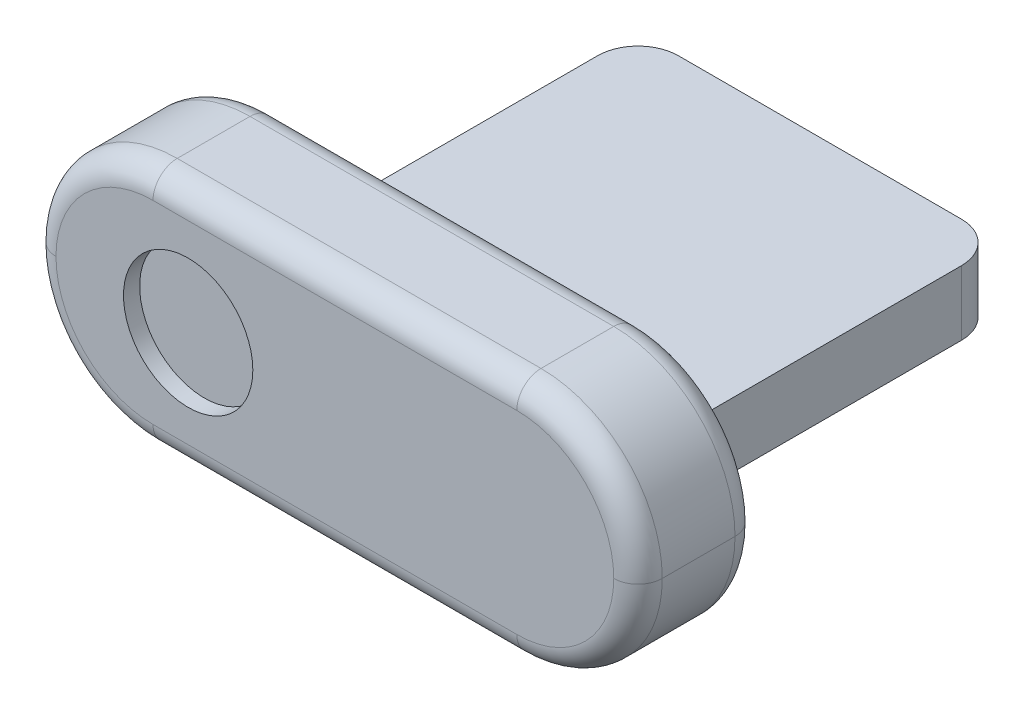
from build123d import *

# Parameters (mm, degrees)
SKETCH1_W           = 75
SKETCH1_H           = 30
BOSS_EXTRUDE1_DEPTH = 15
FILLET1_R           = 15
SKETCH2_W           = 45
SKETCH2_H           = 8
BOSS_EXTRUDE2_DEPTH = 45
FILLET2_R           = 5
FILLET3_R           = 3
SKETCH3_R           = 8
CUT_EXTRUDE1_DEPTH  = 2


with BuildPart() as part:
    # Sketch1 → Boss-Extrude1 (new body)
    with BuildSketch(Plane.XY):
        with Locations((-40, 23.52978815)):
            Rectangle(SKETCH1_W, SKETCH1_H)
    extrude(amount=-BOSS_EXTRUDE1_DEPTH)

    # Fillet1
    fillet1_edges = [part.edges().sort_by_distance(p)[0] for p in [
        (-77.5, 8.52978815, -7.5),
        (-77.5, 38.52978815, -7.5),
        (-2.5, 8.52978815, -7.5),
        (-2.5, 38.52978815, -7.5),
    ]]
    fillet(fillet1_edges, radius=FILLET1_R - 0.0001)  # a hair under: the kernel refuses the full size

    # Sketch2 → Boss-Extrude2 (add)
    with BuildSketch(Plane(origin=(0, 0, -15), x_dir=(-1, 0, 0), z_dir=(0, 0, -1))):
        with Locations((40, 19.52978815)):
            Rectangle(SKETCH2_W, SKETCH2_H)
    extrude(amount=BOSS_EXTRUDE2_DEPTH)

    # Fillet2
    fillet2_edges = [part.edges().sort_by_distance(p)[0] for p in [
        (-62.5, 19.52978815, -60),
        (-17.5, 19.52978815, -60),
    ]]
    fillet(fillet2_edges, radius=FILLET2_R)

    # Fillet3
    fillet3_edges = [part.edges().sort_by_distance(p)[0] for p in [
        (-40, 8.52978815, 0),
        (-40, 38.52978815, 0),
        (-6.893368993, 34.136419158, 0),
        (-6.893368993, 12.923157143, 0),
        (-73.106631007, 34.136419158, 0),
        (-73.106631007, 12.923157143, 0),
        (-40, 8.52978815, -15),
        (-40, 38.52978815, -15),
        (-6.893368993, 34.136419158, -15),
        (-6.893368993, 12.923157143, -15),
        (-73.106631007, 34.136419158, -15),
        (-73.106631007, 12.923157143, -15),
    ]]
    fillet(fillet3_edges, radius=FILLET3_R)

    # Sketch3 → Cut-Extrude1 (cut)
    with BuildSketch(Plane.XY):
        with Locations((-58.148379701, 23.52978815)):
            Circle(SKETCH3_R)
    extrude(amount=-CUT_EXTRUDE1_DEPTH, mode=Mode.SUBTRACT)


solid = part.part
